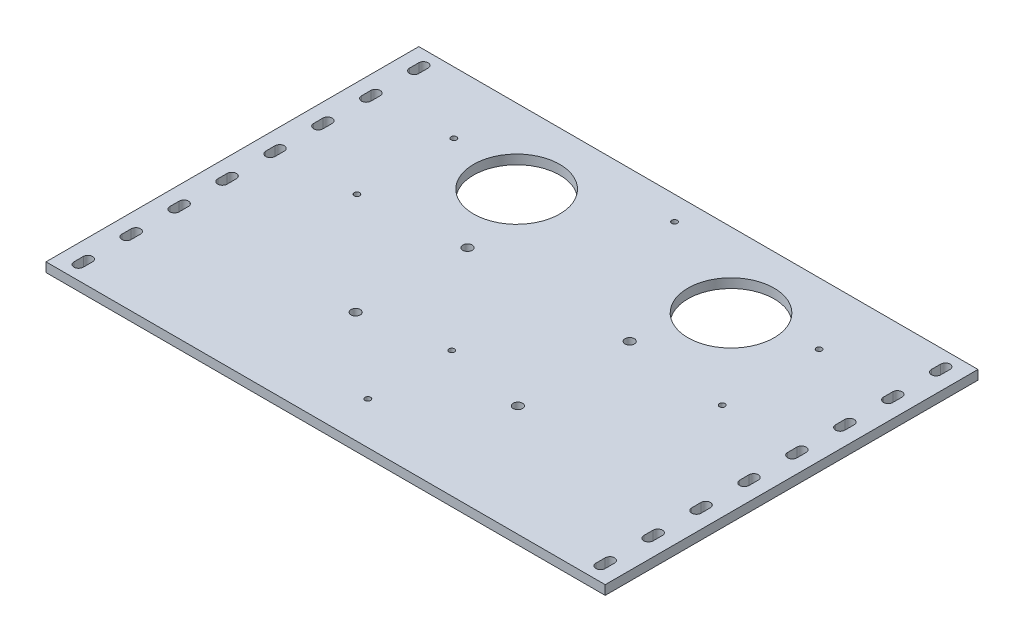
from build123d import *

# Parameters (mm, degrees)
SKETCH_1_W          = 300
SKETCH_1_H          = 200
EXTRUDE_1_DEPTH     = 5
SKETCH_3_R          = 1.5
SKETCH_3_R_2        = 2.5
SKETCH_3_R_3        = 23.1
CUT_EXTRUDE_1_DEPTH = 181.346887969


with BuildPart() as part:
    # 草圖1 → 填料-伸長1 (new body)
    with BuildSketch(Plane(origin=(0, 0, 0), x_dir=(1, 0, 0), z_dir=(0, 1, 0))):
        Rectangle(SKETCH_1_W, SKETCH_1_H)
        with BuildLine():
            Line((-137.5, 92.5), (-137.5, 87.5))
            ThreePointArc((-137.5, 87.5), (-140, 85), (-142.5, 87.5))
            Line((-142.5, 87.5), (-142.5, 92.5))
            ThreePointArc((-142.5, 92.5), (-140, 95), (-137.5, 92.5))
        make_face(mode=Mode.SUBTRACT)
        with BuildLine():
            Line((-137.5, 66.785714286), (-137.5, 61.785714286))
            ThreePointArc((-137.5, 61.785714286), (-140, 59.285714286), (-142.5, 61.785714286))
            Line((-142.5, 61.785714286), (-142.5, 66.785714286))
            ThreePointArc((-142.5, 66.785714286), (-140, 69.285714286), (-137.5, 66.785714286))
        make_face(mode=Mode.SUBTRACT)
        with BuildLine():
            Line((-137.5, 41.071428571), (-137.5, 36.071428571))
            ThreePointArc((-137.5, 36.071428571), (-140, 33.571428571), (-142.5, 36.071428571))
            Line((-142.5, 36.071428571), (-142.5, 41.071428571))
            ThreePointArc((-142.5, 41.071428571), (-140, 43.571428571), (-137.5, 41.071428571))
        make_face(mode=Mode.SUBTRACT)
        with BuildLine():
            Line((-137.5, 15.357142857), (-137.5, 10.357142857))
            ThreePointArc((-137.5, 10.357142857), (-140, 7.857142857), (-142.5, 10.357142857))
            Line((-142.5, 10.357142857), (-142.5, 15.357142857))
            ThreePointArc((-142.5, 15.357142857), (-140, 17.857142857), (-137.5, 15.357142857))
        make_face(mode=Mode.SUBTRACT)
        with BuildLine():
            Line((-137.5, -10.357142857), (-137.5, -15.357142857))
            ThreePointArc((-137.5, -15.357142857), (-140, -17.857142857), (-142.5, -15.357142857))
            Line((-142.5, -15.357142857), (-142.5, -10.357142857))
            ThreePointArc((-142.5, -10.357142857), (-140, -7.857142857), (-137.5, -10.357142857))
        make_face(mode=Mode.SUBTRACT)
        with BuildLine():
            Line((-137.5, -36.071428571), (-137.5, -41.071428571))
            ThreePointArc((-137.5, -41.071428571), (-140, -43.571428571), (-142.5, -41.071428571))
            Line((-142.5, -41.071428571), (-142.5, -36.071428571))
            ThreePointArc((-142.5, -36.071428571), (-140, -33.571428571), (-137.5, -36.071428571))
        make_face(mode=Mode.SUBTRACT)
        with BuildLine():
            Line((-137.5, -61.785714286), (-137.5, -66.785714286))
            ThreePointArc((-137.5, -66.785714286), (-140, -69.285714286), (-142.5, -66.785714286))
            Line((-142.5, -66.785714286), (-142.5, -61.785714286))
            ThreePointArc((-142.5, -61.785714286), (-140, -59.285714286), (-137.5, -61.785714286))
        make_face(mode=Mode.SUBTRACT)
        with BuildLine():
            Line((-137.5, -87.5), (-137.5, -92.5))
            ThreePointArc((-137.5, -92.5), (-140, -95), (-142.5, -92.5))
            Line((-142.5, -92.5), (-142.5, -87.5))
            ThreePointArc((-142.5, -87.5), (-140, -85), (-137.5, -87.5))
        make_face(mode=Mode.SUBTRACT)
        with BuildLine():
            Line((137.5, 92.5), (137.5, 87.5))
            ThreePointArc((137.5, 87.5), (140, 85), (142.5, 87.5))
            Line((142.5, 87.5), (142.5, 92.5))
            ThreePointArc((142.5, 92.5), (140, 95), (137.5, 92.5))
        make_face(mode=Mode.SUBTRACT)
        with BuildLine():
            Line((137.5, 66.785714286), (137.5, 61.785714286))
            ThreePointArc((137.5, 61.785714286), (140, 59.285714286), (142.5, 61.785714286))
            Line((142.5, 61.785714286), (142.5, 66.785714286))
            ThreePointArc((142.5, 66.785714286), (140, 69.285714286), (137.5, 66.785714286))
        make_face(mode=Mode.SUBTRACT)
        with BuildLine():
            Line((137.5, 41.071428571), (137.5, 36.071428571))
            ThreePointArc((137.5, 36.071428571), (140, 33.571428571), (142.5, 36.071428571))
            Line((142.5, 36.071428571), (142.5, 41.071428571))
            ThreePointArc((142.5, 41.071428571), (140, 43.571428571), (137.5, 41.071428571))
        make_face(mode=Mode.SUBTRACT)
        with BuildLine():
            Line((137.5, 15.357142857), (137.5, 10.357142857))
            ThreePointArc((137.5, 10.357142857), (140, 7.857142857), (142.5, 10.357142857))
            Line((142.5, 10.357142857), (142.5, 15.357142857))
            ThreePointArc((142.5, 15.357142857), (140, 17.857142857), (137.5, 15.357142857))
        make_face(mode=Mode.SUBTRACT)
        with BuildLine():
            Line((137.5, -10.357142857), (137.5, -15.357142857))
            ThreePointArc((137.5, -15.357142857), (140, -17.857142857), (142.5, -15.357142857))
            Line((142.5, -15.357142857), (142.5, -10.357142857))
            ThreePointArc((142.5, -10.357142857), (140, -7.857142857), (137.5, -10.357142857))
        make_face(mode=Mode.SUBTRACT)
        with BuildLine():
            Line((137.5, -36.071428571), (137.5, -41.071428571))
            ThreePointArc((137.5, -41.071428571), (140, -43.571428571), (142.5, -41.071428571))
            Line((142.5, -41.071428571), (142.5, -36.071428571))
            ThreePointArc((142.5, -36.071428571), (140, -33.571428571), (137.5, -36.071428571))
        make_face(mode=Mode.SUBTRACT)
        with BuildLine():
            Line((137.5, -61.785714286), (137.5, -66.785714286))
            ThreePointArc((137.5, -66.785714286), (140, -69.285714286), (142.5, -66.785714286))
            Line((142.5, -66.785714286), (142.5, -61.785714286))
            ThreePointArc((142.5, -61.785714286), (140, -59.285714286), (137.5, -61.785714286))
        make_face(mode=Mode.SUBTRACT)
        with BuildLine():
            Line((137.5, -87.5), (137.5, -92.5))
            ThreePointArc((137.5, -92.5), (140, -95), (142.5, -92.5))
            Line((142.5, -92.5), (142.5, -87.5))
            ThreePointArc((142.5, -87.5), (140, -85), (137.5, -87.5))
        make_face(mode=Mode.SUBTRACT)
    extrude(amount=EXTRUDE_1_DEPTH)

    # 草圖3 → 除料-伸長1 (cut, through all)
    with BuildSketch(Plane(origin=(0, 5, 0), x_dir=(1, 0, 0), z_dir=(0, 1, 0))):
        with Locations((0, -77.355339059)):
            Circle(SKETCH_3_R)
        with Locations((0, -32.355339059)):
            Circle(SKETCH_3_R)
        with Locations((-98, 14.785714286)):
            Circle(SKETCH_3_R)
        with Locations((-98, 66.785714286)):
            Circle(SKETCH_3_R)
        with Locations((98, 14.785714286)):
            Circle(SKETCH_3_R)
        with Locations((98, 66.785714286)):
            Circle(SKETCH_3_R)
        with Locations((-43.5, 19.644660941)):
            Circle(SKETCH_3_R_2)
        with Locations((43.5, 19.644660941)):
            Circle(SKETCH_3_R_2)
        with Locations((43.5, -40.355339059)):
            Circle(SKETCH_3_R_2)
        with Locations((-43.5, -40.355339059)):
            Circle(SKETCH_3_R_2)
        with Locations((-57.5, 60)):
            Circle(SKETCH_3_R_3)
        with Locations((57.5, 60)):
            Circle(SKETCH_3_R_3)
        with Locations((0, 87.144660941)):
            Circle(SKETCH_3_R)
    extrude(amount=-CUT_EXTRUDE_1_DEPTH, mode=Mode.SUBTRACT)


solid = part.part
